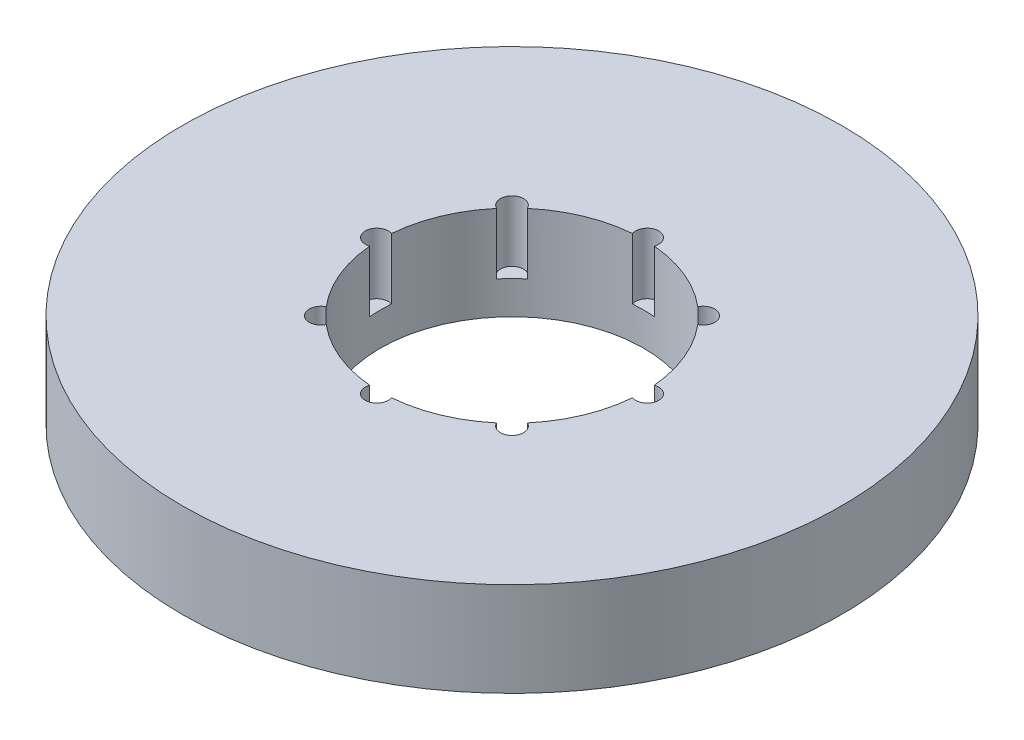
from build123d import *

# Parameters (mm, degrees)
SKETCH1_R           = 87.5
BOSS_EXTRUDE1_DEPTH = 25
SKETCH2_R           = 35
CUT_EXTRUDE1_DEPTH  = 127.24381173
SKETCH3_R           = 3.065894524
CUT_EXTRUDE2_DEPTH  = 16.222205047
CIRPATTERN1_COUNT   = 8


with BuildPart() as part:
    # Sketch1 → Boss-Extrude1 (new body)
    with BuildSketch(Plane(origin=(0, 0, 0), x_dir=(1, 0, 0), z_dir=(0, 1, 0))):
        Circle(SKETCH1_R)
    extrude(amount=BOSS_EXTRUDE1_DEPTH)

    # Sketch2 → Cut-Extrude1 (cut, through all)
    with BuildSketch(Plane(origin=(0, 0, 0), x_dir=(1, 0, 0), z_dir=(0, 1, 0))):
        Circle(SKETCH2_R)
    extrude(amount=CUT_EXTRUDE1_DEPTH, mode=Mode.SUBTRACT)

    # Sketch3 → Cut-Extrude2 (cut)
    with BuildSketch(Plane(origin=(0, 25, 0), x_dir=(1, 0, 0), z_dir=(0, 1, 0))):
        with Locations((-35.895978418, 0)):
            Circle(SKETCH3_R)
    cut_extrude2 = extrude(amount=-CUT_EXTRUDE2_DEPTH, mode=Mode.SUBTRACT)

    # CirPattern1: Cut-Extrude2 ×8 about axis
    cirpattern1_axis = Axis((0, 0, 0), (0, 1, 0))
    for i in range(1, CIRPATTERN1_COUNT):
        add(cut_extrude2.rotate(cirpattern1_axis, i * 360 / CIRPATTERN1_COUNT), mode=Mode.SUBTRACT)


solid = part.part
